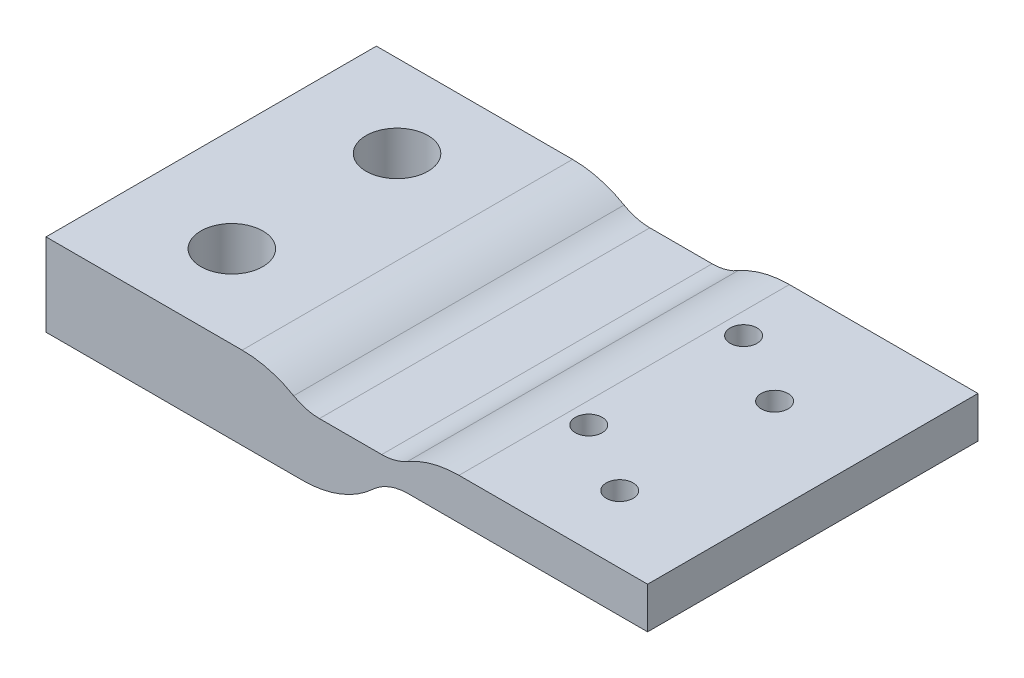
from build123d import *

# Parameters (mm, degrees)
SKETCH1_W               = 21.333333334
SKETCH1_H               = 32
BOSS_EXTRUDE1_DEPTH     = 5
SKETCH2_W               = 37.6
SKETCH2_H               = 32
BOSS_EXTRUDE2_DEPTH     = 5
SKETCH7_R               = 1.3
CUT_EXTRUDE2_DEPTH      = 10
CUT_EXTRUDE3_DEPTH      = 51.465433715
CUT_EXTRUDE3_DEPTH_BACK = 51.465433715
SKETCH8_W               = 25.4
SKETCH8_H               = 1
SKETCH8_W_2             = 9
SKETCH8_H_2             = 2
SKETCH9_W               = 32.866666667
SKETCH9_H               = 32
BOSS_EXTRUDE3_DEPTH     = 3
CUT_EXTRUDE4_DEPTH      = 51.465433715
CUT_EXTRUDE4_DEPTH_BACK = 51.465433715
SKETCH10_R              = 3
CUT_EXTRUDE5_DEPTH      = 8
FILLET8_R               = 3
FILLET9_R               = 10
FILLET10_R              = 5


with BuildPart() as part:
    # Sketch1 → Boss-Extrude1 (new body)
    with BuildSketch(Plane(origin=(0, 0, 0), x_dir=(1, 0, 0), z_dir=(0, 1, 0))):
        Rectangle(SKETCH1_W, SKETCH1_H)
    extrude(amount=BOSS_EXTRUDE1_DEPTH)

    # Sketch2 → Boss-Extrude2 (add)
    with BuildSketch(Plane(origin=(0, 0, 0), x_dir=(1, 0, 0), z_dir=(0, 1, 0))):
        with Locations((28.8, 0)):
            Rectangle(SKETCH2_W, SKETCH2_H)
    extrude(amount=BOSS_EXTRUDE2_DEPTH)

    # Sketch7 → Cut-Extrude2 (cut)
    with BuildSketch(Plane(origin=(0, 0, 0), x_dir=(1, 0, 0), z_dir=(0, 1, 0))):
        with Locations(Location((38.4, -9.5, 0), (0, 0, 90))):
            Circle(SKETCH7_R)
        with Locations(Location((31.4, -5.5, 0), (0, 0, 90))):
            Circle(SKETCH7_R)
        with Locations(Location((38.4, 5.5, 0), (0, 0, 90))):
            Circle(SKETCH7_R)
        with Locations(Location((31.4, 9.5, 0), (0, 0, 90))):
            Circle(SKETCH7_R)
    extrude(amount=CUT_EXTRUDE2_DEPTH, mode=Mode.SUBTRACT)

    # Sketch8 → Cut-Extrude3 (cut, two sides: drawn at the far end of the back side and taken through both)
    with BuildSketch(Plane.XY.offset(-CUT_EXTRUDE3_DEPTH_BACK)):
        with Locations((34.9, 0.5)):
            Rectangle(SKETCH8_W, SKETCH8_H)
        with Locations((18.833333333, 4)):
            Rectangle(SKETCH8_W_2, SKETCH8_H_2)
    extrude(amount=CUT_EXTRUDE3_DEPTH + CUT_EXTRUDE3_DEPTH_BACK, mode=Mode.SUBTRACT)

    # Sketch9 → Boss-Extrude3 (add)
    with BuildSketch(Plane(origin=(0, 0, 0), x_dir=(1, 0, 0), z_dir=(0, 1, 0))):
        with Locations((5.766666667, 0)):
            Rectangle(SKETCH9_W, SKETCH9_H)
    extrude(amount=-BOSS_EXTRUDE3_DEPTH)

    # Sketch10 → Cut-Extrude4 (cut, two sides: drawn at the far end of the back side and taken through both)
    with BuildSketch(Plane(origin=(0, 0, 0), x_dir=(1, 0, 0), z_dir=(0, 1, 0)).offset(-CUT_EXTRUDE4_DEPTH_BACK)):
        with Locations(Location((-0.666666667, 8, 0), (0, 0, 270))):
            Circle(SKETCH10_R)
        with Locations(Location((-0.666666667, -8, 0), (0, 0, 270))):
            Circle(SKETCH10_R)
    extrude(amount=CUT_EXTRUDE4_DEPTH + CUT_EXTRUDE4_DEPTH_BACK, mode=Mode.SUBTRACT)

    # Sketch11 → Cut-Extrude5 (cut)
    with BuildSketch(Plane(origin=(0, 0, 0), x_dir=(1, 0, 0), z_dir=(0, 1, 0))):
        with BuildLine():
            Line((-5.866666667, 8), (-5.866666667, -8))
            ThreePointArc((-5.866666667, -8), (-0.666666667, -13.2), (4.533333333, -8))
            Line((4.533333333, -8), (4.533333333, 8))
            ThreePointArc((4.533333333, 8), (-0.666666667, 13.2), (-5.866666667, 8))
        make_face()
    extrude(amount=-CUT_EXTRUDE5_DEPTH, mode=Mode.SUBTRACT)

    # Fillet8
    # the kernel refuses this fillet: 3 mm, written as the material it takes off along each edge
    with BuildSketch(Plane(origin=(-0.666666667, -3, -8), x_dir=(1, 0, 0), z_dir=(0, 0, 1))) as fillet8_piece_1:
        with BuildLine():
            CenterArc((5.2 + FILLET8_R, FILLET8_R), FILLET8_R, 180, 90)
            Line((5.2, FILLET8_R), (5.2, 0))
            Line((5.2, 0), (5.2 + FILLET8_R, 0))
        make_face()
    revolve(axis=Axis((-0.666666667, -3, -8), (0, 1, 0)), revolution_arc=180, mode=Mode.SUBTRACT)
    with BuildSketch(Plane(origin=(-0.666666667, -3, 8), x_dir=(-1, 0, 0), z_dir=(0, 0, -1))) as fillet8_piece_2:
        with BuildLine():
            CenterArc((5.2 + FILLET8_R, FILLET8_R), FILLET8_R, 180, 90)
            Line((5.2, FILLET8_R), (5.2, 0))
            Line((5.2, 0), (5.2 + FILLET8_R, 0))
        make_face()
    revolve(axis=Axis((-0.666666667, -3, 8), (0, 1, 0)), revolution_arc=180, mode=Mode.SUBTRACT)
    with BuildSketch(Plane(origin=(-5.866666667, -3, 8), x_dir=(-1, 0, 0), z_dir=(0, 0, -1)), Plane(origin=(4.533333333, -3, -8), x_dir=(1, 0, 0), z_dir=(0, 0, 1))) as fillet8_piece_3:
        with BuildLine():
            CenterArc((FILLET8_R, FILLET8_R), FILLET8_R, 180, 90)
            Line((0, FILLET8_R), (0, 0))
            Line((0, 0), (FILLET8_R, 0))
        make_face()
    extrude(amount=16, mode=Mode.SUBTRACT)

    # Fillet9
    # the kernel refuses this fillet: 10 mm, written as the material it takes off along each edge
    with BuildSketch(Plane(origin=(23.333333333, 5, 31), x_dir=(0, -1, 0), z_dir=(0, 0, -1))) as fillet9_piece_1:
        with BuildLine():
            CenterArc((10, -6), FILLET9_R, 143.130102354, 36.869897646)
            Line((0, -6), (-0.2, -6))
            Line((-0.2, -6), (-0.2, 0))
            Line((-0.2, 0), (0, 0.2))
            ThreePointArc((0, 0.2), (1, 0.2), (1.84, 0.12))
            Line((1.84, 0.12), (2, 0))
        make_face()
    extrude(amount=62, mode=Mode.SUBTRACT)
    with BuildSketch(Plane(origin=(14.333333333, 5, -31), x_dir=(-1, 0, 0), z_dir=(0, 0, 1))) as fillet9_piece_2:
        with BuildLine():
            CenterArc((6, 10), FILLET9_R, 233.130102354, 36.869897646)
            Line((0, 2), (-0.12, 1.84))
            ThreePointArc((-0.12, 1.84), (-0.2, 1), (-0.2, 0))
            Line((-0.2, 0), (0, -0.2))
            Line((0, -0.2), (6, -0.2))
            Line((6, -0.2), (6, 0))
        make_face()
    extrude(amount=62, mode=Mode.SUBTRACT)
    with BuildSketch(Plane(origin=(22.2, -3, -36), x_dir=(0, 1, 0), z_dir=(0, 0, 1))) as fillet9_piece_3:
        with BuildLine():
            CenterArc((10, 8), FILLET9_R, 180, 53.130102354)
            Line((0, 8), (-0.2, 8))
            Line((-0.2, 8), (-0.2, 0))
            Line((-0.2, 0), (0, -0.2))
            ThreePointArc((0, -0.2), (2, -0.2), (3.88, -0.16))
            Line((3.88, -0.16), (4, 0))
        make_face()
    extrude(amount=72, mode=Mode.SUBTRACT)

    # Fillet10
    fillet10_edges = [part.edges().sort_by_distance(p)[0] for p in [
        (22.2, 1, 0),
        (14.333333333, 3, 0),
        (23.333333333, 3, 0),
    ]]
    fillet(fillet10_edges, radius=FILLET10_R)


solid = part.part
